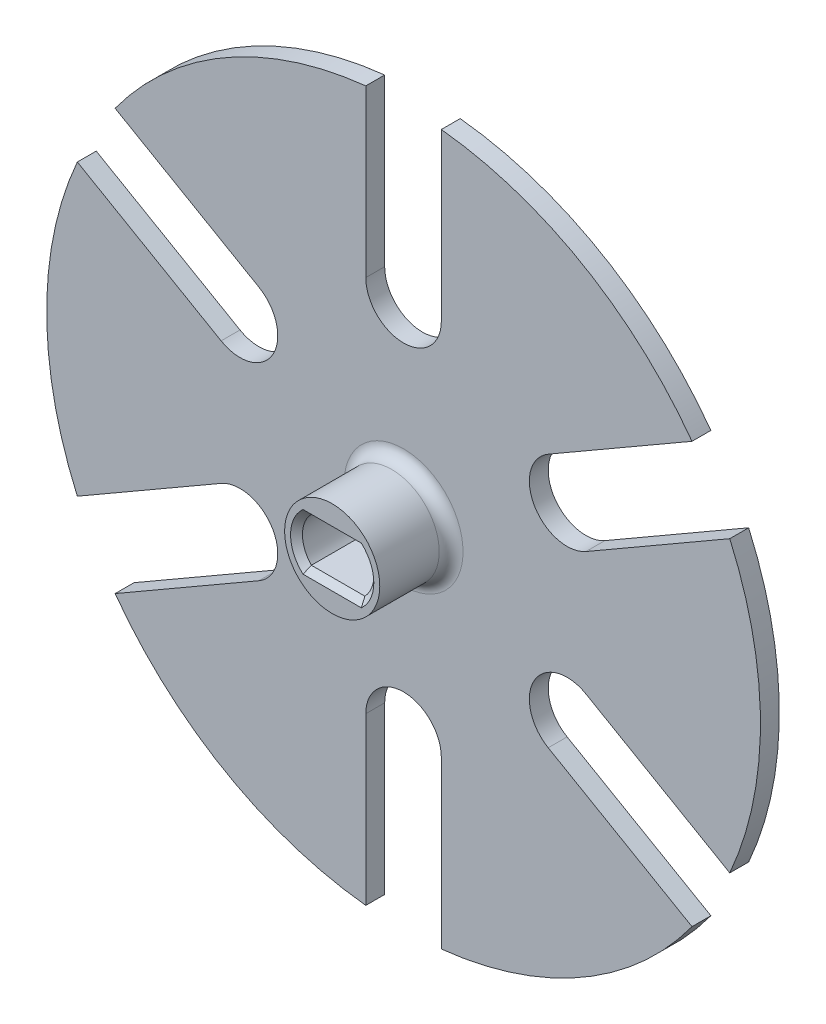
from build123d import *

# Parameters (mm, degrees)
SKETCH1_R           = 4
BOSS_EXTRUDE1_DEPTH = 6
SKETCH2_R           = 30
BOSS_EXTRUDE2_DEPTH = 1.5875
FILLET1_R           = 1
CHAMFER1_SIZE       = 0.5
CUT_EXTRUDE2_DEPTH  = 43.848570585
CIRPATTERN2_COUNT   = 6


with BuildPart() as part:
    # Sketch1 → Boss-Extrude1 (new body)
    with BuildSketch(Plane.XY):
        Circle(SKETCH1_R)
        with BuildLine():
            Line((-2.25, 1.855), (2.25, 1.855))
            ThreePointArc((2.25, 1.855), (3, 0), (2.25, -1.855))
            Line((2.25, -1.855), (-2.25, -1.855))
            ThreePointArc((-2.25, -1.855), (-3, 0), (-2.25, 1.855))
        make_face(mode=Mode.SUBTRACT)
    extrude(amount=BOSS_EXTRUDE1_DEPTH)

    # Sketch2 → Boss-Extrude2 (add)
    with BuildSketch(Plane(origin=(0, 0, 0), x_dir=(-1, 0, 0), z_dir=(0, 0, -1))):
        Circle(SKETCH2_R)
    extrude(amount=BOSS_EXTRUDE2_DEPTH)

    # Fillet1
    fillet1_edges = [part.edges().sort_by_distance(p)[0] for p in [
        (-4, 0, 0),
    ]]
    fillet(fillet1_edges, radius=FILLET1_R)

    # Chamfer1
    chamfer1_edges = [part.edges().sort_by_distance(p)[0] for p in [
        (3, 0, 6),
    ]]
    chamfer(chamfer1_edges, length=CHAMFER1_SIZE)
    chamfer1_2_edges = [part.edges().sort_by_distance(p)[0] for p in [
        (0, -1.855, 6),
    ]]
    chamfer(chamfer1_2_edges, length=CHAMFER1_SIZE)
    chamfer1_3_edges = [part.edges().sort_by_distance(p)[0] for p in [
        (-3, 0, 6),
    ]]
    chamfer(chamfer1_3_edges, length=CHAMFER1_SIZE)
    chamfer1_4_edges = [part.edges().sort_by_distance(p)[0] for p in [
        (0, 1.855, 6),
    ]]
    chamfer(chamfer1_4_edges, length=CHAMFER1_SIZE)

    # Sketch4 → Cut-Extrude2 (cut, through all)
    with BuildSketch(Plane.XY):
        with BuildLine():
            Line((3.175, 66.675), (3.175, 15.875))
            ThreePointArc((3.175, 15.875), (0, 12.7), (-3.175, 15.875))
            Line((-3.175, 15.875), (-3.175, 66.675))
            ThreePointArc((-3.175, 66.675), (0, 69.85), (3.175, 66.675))
        make_face()
    cut_extrude2 = extrude(amount=-CUT_EXTRUDE2_DEPTH, mode=Mode.SUBTRACT)

    # CirPattern2: Cut-Extrude2 ×6 about axis
    cirpattern2_axis = Axis((0, 0, -1.5875), (0, 0, 1))
    for i in range(1, CIRPATTERN2_COUNT):
        add(cut_extrude2.rotate(cirpattern2_axis, i * 360 / CIRPATTERN2_COUNT), mode=Mode.SUBTRACT)


solid = part.part
